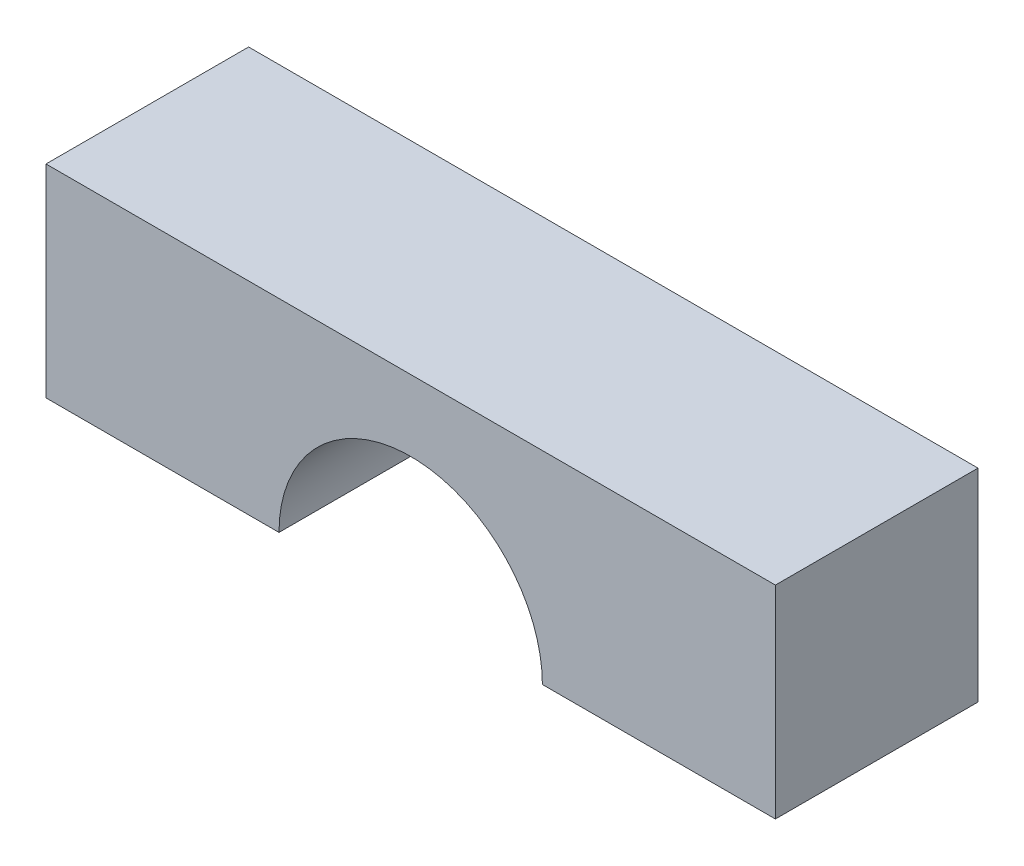
from build123d import *

# Parameters (mm, degrees)
BOSS_EXTRUDE1_DEPTH = 5


with BuildPart() as part:
    # Sketch1 → Boss-Extrude1 (new body)
    with BuildSketch(Plane.XY):
        with BuildLine():
            Line((3.25, 0), (9, 0))
            Line((9, 0), (9, 5))
            Line((9, 5), (-9, 5))
            Line((-9, 5), (-9, 0))
            Line((-9, 0), (-3.25, 0))
            ThreePointArc((-3.25, 0), (0, 3.25), (3.25, 0))
        make_face()
    extrude(amount=BOSS_EXTRUDE1_DEPTH)


solid = part.part
